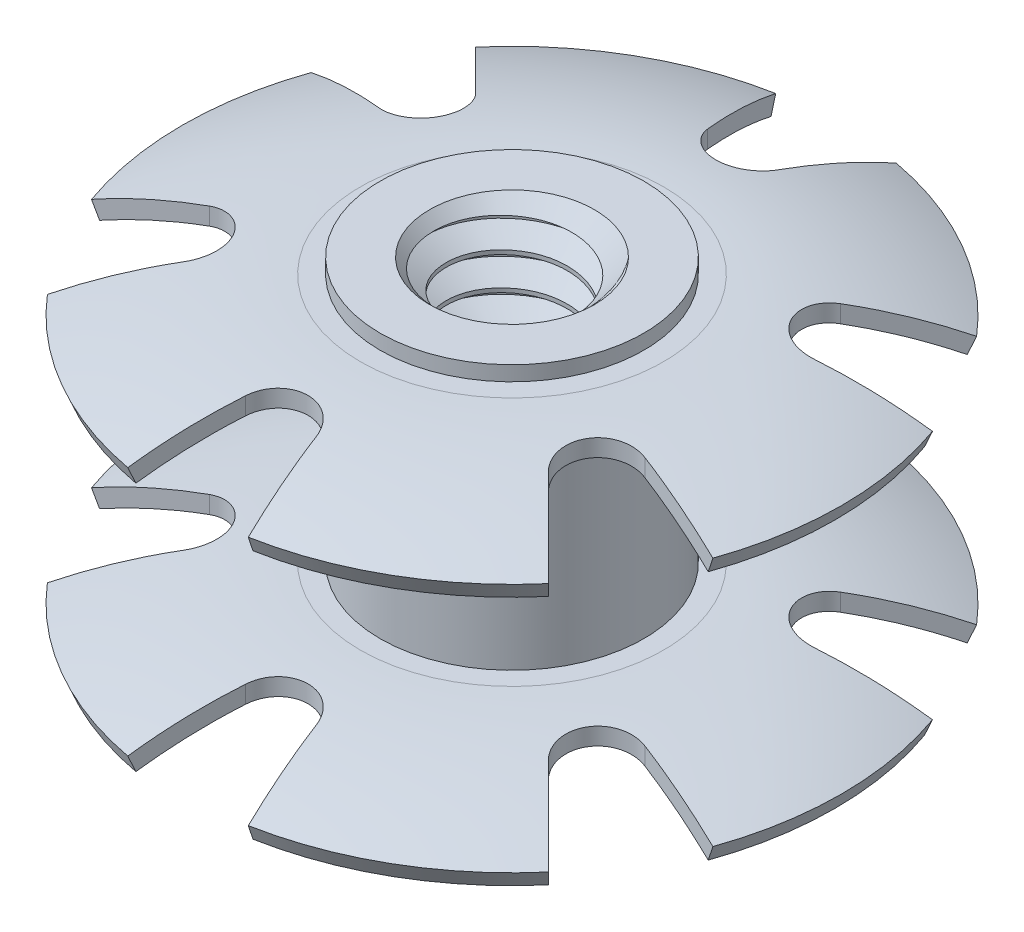
from build123d import *

# Parameters (mm, degrees)
SWEEP1_PITCH       = 1.27
SKETCH4_R          = 5.08
CUT_EXTRUDE1_DEPTH = 17.276482707
SKETCH5_R          = 5.08
CUT_EXTRUDE2_DEPTH = 14.500285342
CUT_EXTRUDE5_DEPTH = 22.700584232
CIRPATTERN1_COUNT  = 6


with BuildPart() as part:
    # Sketch1 → Revolve1 (revolve)
    with BuildSketch(Plane.XY, mode=Mode.PRIVATE) as revolve1_sk:
        Polygon((-5.08, 5.715), (-3.175, 5.715), (-3.175, -5.715), (-5.08, -5.715), (-5.08, -5.1435), (-4.572, -5.1435), (-4.572, -4.4831), (-5.08, -4.4831), (-5.08, 4.4831), (-4.572, 4.4831), (-4.572, 5.1435), (-5.08, 5.1435), align=None)
    revolve(revolve1_sk.sketch.rotate(Axis((0, 0, 0), (0, 1, 0)), 270), axis=Axis((0, 0, 0), (0, 1, 0)))

    # Sweep1: the profile of Sketch3 profile screwed along a right-hand helix of 11.5 turns, 6 arcs to a turn; built about Z, then put on its axis
    sweep1_z = Axis((0, 0, 0), (0, 0, 1))
    sweep1_corners = [(2.350110803, 0, -0.635), (2.350110803, 0, -0.47625), (3.1753, 0, 0.000173205), (3.1753, 0, -1.111423205)]
    with BuildLine(mode=Mode.PRIVATE) as sweep1_profile:
        Line(sweep1_corners[0], sweep1_corners[1])
        Line(sweep1_corners[1], sweep1_corners[2])
        Line(sweep1_corners[2], sweep1_corners[3])
        Line(sweep1_corners[3], sweep1_corners[0])
    sweep1_cap = Face(sweep1_profile.wire())
    sweep1_turn_angles = [0, 30, 60, 90, 120, 150, 180, 210, 240, 270, 300, 330, 360]
    sweep1_turn_weights = [1, 0.8660254037844387, 1, 0.8660254037844387, 1, 0.8660254037844387, 1, 0.8660254037844387, 1, 0.8660254037844387, 1, 0.8660254037844387, 1]
    sweep1_turn_rails = [Edge.make_bspline([Vector(p[0], p[1], 0).rotate(sweep1_z, sweep1_turn_angles[k]) / sweep1_turn_weights[k] + Vector(0, 0, p[2] + SWEEP1_PITCH * sweep1_turn_angles[k] / 360) for k in range(13)], [0, 0, 0, 1, 1, 2, 2, 3, 3, 4, 4, 5, 5, 6, 6, 6], 2, sweep1_turn_weights) for p in sweep1_corners]
    sweep1_turn_sides = [Face.make_surface_from_curves(sweep1_turn_rails[p[0]], sweep1_turn_rails[p[1]]) for p in [(0, 1), (1, 2), (2, 3), (3, 0)]]
    sweep1_last_angles = [3960, 3990, 4020, 4050, 4080, 4110, 4140]
    sweep1_last_weights = [1, 0.8660254037844387, 1, 0.8660254037844387, 1, 0.8660254037844743, 1]
    sweep1_last_rails = [Edge.make_bspline([Vector(p[0], p[1], 0).rotate(sweep1_z, sweep1_last_angles[k]) / sweep1_last_weights[k] + Vector(0, 0, p[2] + SWEEP1_PITCH * sweep1_last_angles[k] / 360) for k in range(7)], [0, 0, 0, 1, 1, 2, 2, 3, 3, 3], 2, sweep1_last_weights) for p in sweep1_corners]
    sweep1_last_sides = [Face.make_surface_from_curves(sweep1_last_rails[p[0]], sweep1_last_rails[p[1]]) for p in [(0, 1), (1, 2), (2, 3), (3, 0)]]
    sweep1 = Plane(origin=(0, 5.715, 0), x_dir=(1, 0, 0), z_dir=(0, -1, 0)) * Solid(Shell([*[p.moved(Location((0, 0, SWEEP1_PITCH * i))) for i in range(11) for p in sweep1_turn_sides], *sweep1_last_sides, sweep1_cap, sweep1_cap.rotate(sweep1_z, 4140).moved(Location((0, 0, SWEEP1_PITCH * 4140 / 360)))]))
    add(sweep1)

    # Sketch4 → Cut-Extrude1 (cut, through all)
    with BuildSketch(Plane(origin=(0, 5.715, 0), x_dir=(1, 0, 0), z_dir=(0, 1, 0))):
        with Locations(Location((0, 0, 0), (0, 0, 90))):
            Circle(SKETCH4_R)
    extrude(amount=CUT_EXTRUDE1_DEPTH, mode=Mode.SUBTRACT)

    # Sketch5 → Cut-Extrude2 (cut, through all)
    with BuildSketch(Plane.XZ.offset(5.715)):
        with Locations(Location((0, 0, 0), (0, 0, 270))):
            Circle(SKETCH5_R)
    extrude(amount=CUT_EXTRUDE2_DEPTH, mode=Mode.SUBTRACT)

    # Cut-Extrude3 cone 1 section (through the dimple's axis) → Cut-Extrude3 (revolve, cut)
    with BuildSketch(Plane(origin=(0, -5.715, 0), x_dir=(0, 0, -1), z_dir=(1, 0, 0))):
        Polygon((0, 0), (3.175, 0), (0, 3.175), align=None)
    revolve(axis=Axis((0, -5.715, 0), (0, 1, 0)), mode=Mode.SUBTRACT)

    # Cut-Extrude4 cone 1 section (through the dimple's axis) → Cut-Extrude4 (revolve, cut)
    with BuildSketch(Plane(origin=(0, 5.715, 0), x_dir=(0, 0, 1), z_dir=(1, 0, 0))):
        Polygon((0, 0), (3.175, 0), (0, 3.175), align=None)
    revolve(axis=Axis((0, 5.715, 0), (0, -1, 0)), mode=Mode.SUBTRACT)

    # Sketch8 → Revolve2 (revolve)
    with BuildSketch(Plane.XY, mode=Mode.PRIVATE) as revolve2_sk:
        with BuildLine():
            Line((-5.842, 5.1435), (-4.572, 5.1435))
            Line((-4.572, 5.1435), (-4.572, 4.4831))
            Line((-4.572, 4.4831), (-5.842, 4.4831))
            ThreePointArc((-5.842, 4.4831), (-9.209392487, 4.149662434), (-12.446, 3.1623))
            Line((-12.446, 3.1623), (-12.7, 3.7719))
            ThreePointArc((-12.7, 3.7719), (-9.338907582, 4.797237912), (-5.842, 5.1435))
        make_face()
        with BuildLine():
            Line((-5.842, -4.4831), (-4.572, -4.4831))
            Line((-4.572, -4.4831), (-4.572, -5.1435))
            Line((-4.572, -5.1435), (-5.842, -5.1435))
            ThreePointArc((-5.842, -5.1435), (-9.209392487, -5.476937566), (-12.446, -6.4643))
            Line((-12.446, -6.4643), (-12.7, -5.8547))
            ThreePointArc((-12.7, -5.8547), (-9.338907582, -4.829362088), (-5.842, -4.4831))
        make_face()
    revolve(revolve2_sk.sketch.rotate(Axis((0, 0, 0), (0, 1, 0)), 270), axis=Axis((0, 0, 0), (0, 1, 0)))

    # Sketch9 → Cut-Extrude5 (cut, through all)
    with BuildSketch(Plane(origin=(0, 5.715, 0), x_dir=(1, 0, 0), z_dir=(0, 1, 0))):
        with BuildLine():
            Line((-1.363028666, 8.90577757), (-2.322310718, 12.485866927))
            ThreePointArc((-2.322310718, 12.485866927), (0, 12.7), (2.322310718, 12.485866927))
            Line((2.322310718, 12.485866927), (1.363028666, 8.90577757))
            ThreePointArc((1.363028666, 8.90577757), (0, 7.859888889), (-1.363028666, 8.90577757))
        make_face()
    cut_extrude5 = extrude(amount=-CUT_EXTRUDE5_DEPTH, mode=Mode.SUBTRACT)

    # CirPattern1: Cut-Extrude5 ×6 about axis
    cirpattern1_axis = Axis((0, 0, 0), (0, 1, 0))
    for i in range(1, CIRPATTERN1_COUNT):
        add(cut_extrude5.rotate(cirpattern1_axis, i * 360 / CIRPATTERN1_COUNT), mode=Mode.SUBTRACT)


solid = part.part
